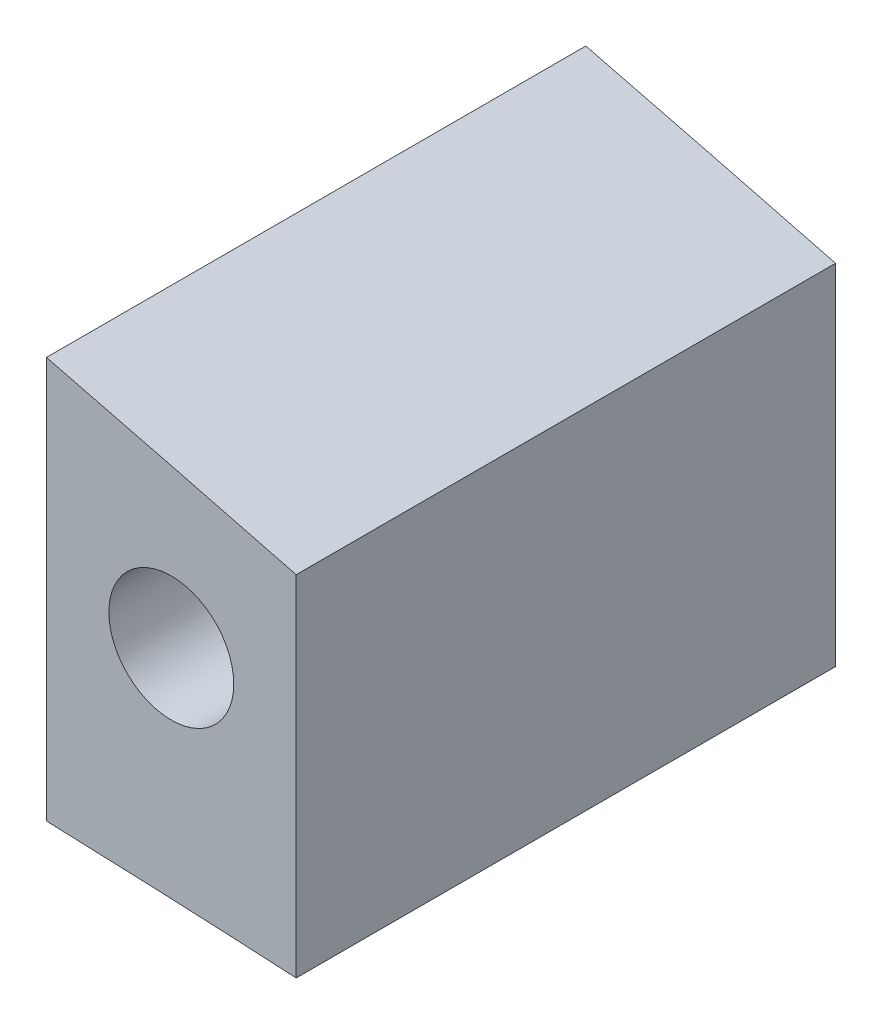
from build123d import *

# Parameters (mm, degrees)
BOSS_EXTRUDE1_DEPTH = 27.432
SKETCH2_R           = 6.35
SKETCH2_R_2         = 3.175
SKETCH2_W           = 157.234350826
SKETCH2_H           = 154.50631004
CUT_EXTRUDE1_DEPTH  = 317.917465392
SKETCH3_W           = 293.18888876
SKETCH3_H           = 137.971241769
CUT_EXTRUDE2_DEPTH  = 241.147718716


with BuildPart() as part:
    # Sketch1 → Boss-Extrude1 (new body)
    with BuildSketch(Plane.XY):
        with BuildLine():
            add(Edge.make_bspline(
                [(0.000560351, 0.000130087), (0.810633127, 7.359196055), (8.649092025, 17.856605174), (26.286719818, 29.975176328), (52.111128271, 42.069215275), (89.597618475, 49.290763054), (131.400792109, 47.884831915), (173.256699242, 40.041104278), (217.961060472, 29.612974894), (256.952064401, 19.528920948), (290.35983767, 8.71099439), (301.273197721, 4.382828139), (314.816918223, -0.516206742), (309.846313895, 0.000130087)],
                knots=[0, 0, 0, 0, 0.060863618, 0.113688265, 0.188608742, 0.312908923, 0.448482434, 0.557612135, 0.691544113, 0.852438279, 0.92975597, 0.976058229, 1, 1, 1, 1], degree=3))
            add(Edge.make_bspline(
                [(309.846313895, 0.000130087), (303.956832565, 1.47095521), (293.989507544, 2.093987313), (276.26402299, 4.514356704), (260.846344817, 5.427413394), (235.858814759, 7.870306192), (205.101424636, 8.838080282), (157.718638092, 9.030650149), (110.497331172, 6.181495223), (66.506197185, -0.586669107), (36.454672816, -6.098499901), (15.316603331, -6.189065841), (1.230714189, -6.924076091), (0.000560351, 0.000130087)],
                knots=[0, 0, 0, 0, 0.057787081, 0.095274891, 0.171021118, 0.205339302, 0.335319146, 0.464904334, 0.658702312, 0.785511947, 0.893517288, 0.94309214, 1, 1, 1, 1], degree=3))
        make_face()
    extrude(amount=BOSS_EXTRUDE1_DEPTH)

    # Sketch2 → Cut-Extrude1 (cut, through all)
    with BuildSketch(Plane.XY.offset(27.432)):
        with Locations((20.32, 10.16)):
            Circle(SKETCH2_R)
        with Locations((227.296313895, 19.050130087)):
            Circle(SKETCH2_R_2)
        with Locations((312.263489308, 28.906285069)):
            Rectangle(SKETCH2_W, SKETCH2_H)
    extrude(amount=-CUT_EXTRUDE1_DEPTH, mode=Mode.SUBTRACT)

    # Sketch3 → Cut-Extrude2 (cut, through all)
    with BuildSketch(Plane.XY.offset(27.432)):
        with Locations((74.351869515, 11.449549126)):
            Rectangle(SKETCH3_W, SKETCH3_H)
    extrude(amount=-CUT_EXTRUDE2_DEPTH, mode=Mode.SUBTRACT)


solid = part.part
